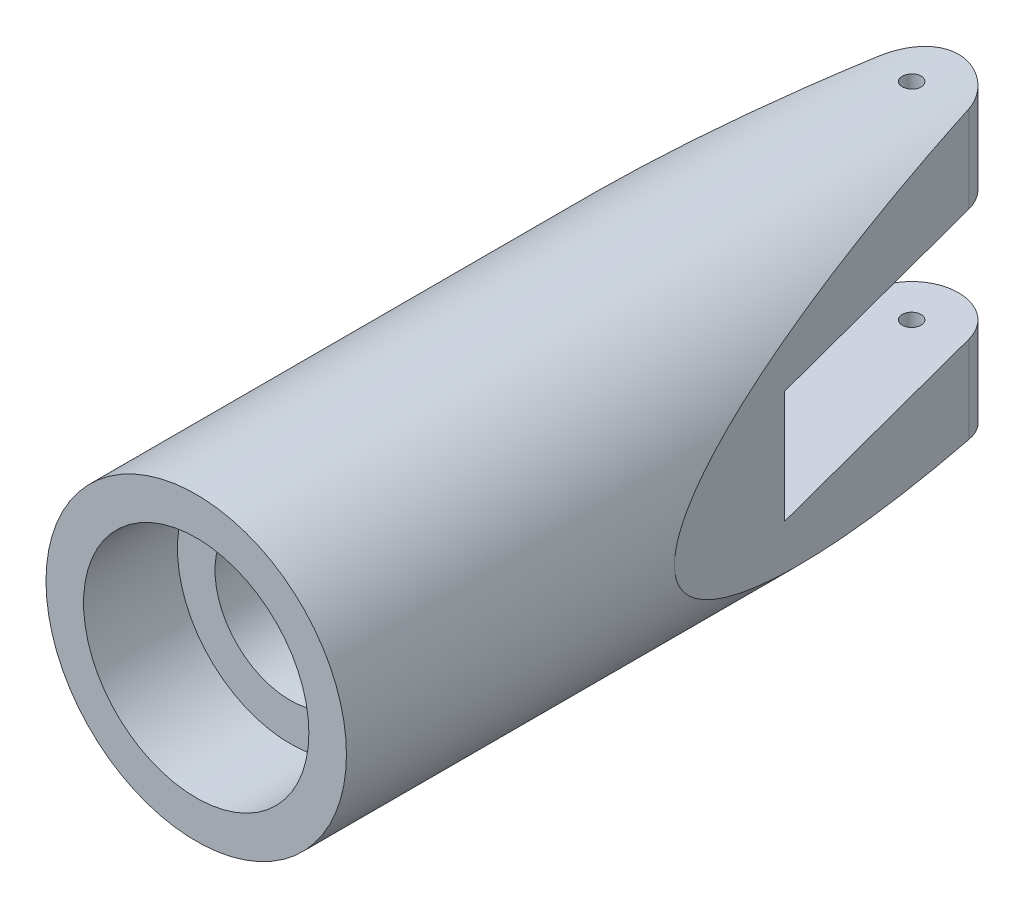
from build123d import *

# Parameters (mm, degrees)
CUT_EXTRUDE2_DEPTH      = 28.8057548
CUT_EXTRUDE2_DEPTH_BACK = 28.8057548
CUT_EXTRUDE3_DEPTH      = 28.805754949
CUT_EXTRUDE3_DEPTH_BACK = 28.805754949
SKETCH4_W               = 25.011127608
SKETCH4_H               = 6
CUT_EXTRUDE4_DEPTH      = 28.805754949
CUT_EXTRUDE4_DEPTH_BACK = 6
SKETCH3_4_R             = 0.5


with BuildPart() as part:
    # Sketch2 → Revolve1 (revolve)
    with BuildSketch(Plane(origin=(0, 0, 0), x_dir=(0, 0, -1), z_dir=(1, 0, 0))):
        Polygon((-20.4, 4), (0, 4), (0, 3), (20, 3), (20, 8), (-25.4, 8), (-25.4, 6), (-20.4, 6), align=None)
    revolve(axis=Axis((0, 0, 12.975169934), (0, 0, -1)))

    # Sketch3 → Cut-Extrude2 (cut, two sides: drawn at the far end of the back side and taken through both)
    with BuildSketch(Plane(origin=(0, 0, 0), x_dir=(1, 0, 0), z_dir=(0, 1, 0)).offset(-CUT_EXTRUDE2_DEPTH_BACK)):
        with BuildLine():
            Line((11.690295323, -21.990417525), (11.690295323, 25))
            Line((11.690295323, 25), (-11.690295323, 25))
            Line((-11.690295323, 25), (-11.690295323, -21.990417525))
            Line((-11.690295323, -21.990417525), (-2.418088127, 13.334704506))
            ThreePointArc((-2.418088127, 13.334704506), (0, 15.2), (2.418088127, 13.334704506))
            Line((2.418088127, 13.334704506), (11.690295323, -21.990417525))
        make_face()
    extrude(amount=CUT_EXTRUDE2_DEPTH + CUT_EXTRUDE2_DEPTH_BACK, mode=Mode.SUBTRACT)

    # Sketch4 → Cut-Extrude3 (cut, two sides: drawn at the far end of the back side and taken through both)
    with BuildSketch(Plane(origin=(0, 0, 0), x_dir=(0, 0, -1), z_dir=(1, 0, 0)).offset(-CUT_EXTRUDE3_DEPTH_BACK)):
        with Locations((12.505563804, 0)):
            Rectangle(SKETCH4_W, SKETCH4_H)
    extrude(amount=CUT_EXTRUDE3_DEPTH + CUT_EXTRUDE3_DEPTH_BACK, mode=Mode.SUBTRACT)

    # Sketch3<4> → Cut-Extrude4 (cut, two sides: drawn at the far end of the back side and taken through both)
    with BuildSketch(Plane(origin=(0, 0, 0), x_dir=(1, 0, 0), z_dir=(0, 1, 0)).offset(-CUT_EXTRUDE4_DEPTH_BACK)):
        with Locations((0, 12.7)):
            Circle(SKETCH3_4_R)
    extrude(amount=CUT_EXTRUDE4_DEPTH + CUT_EXTRUDE4_DEPTH_BACK, mode=Mode.SUBTRACT)


solid = part.part
